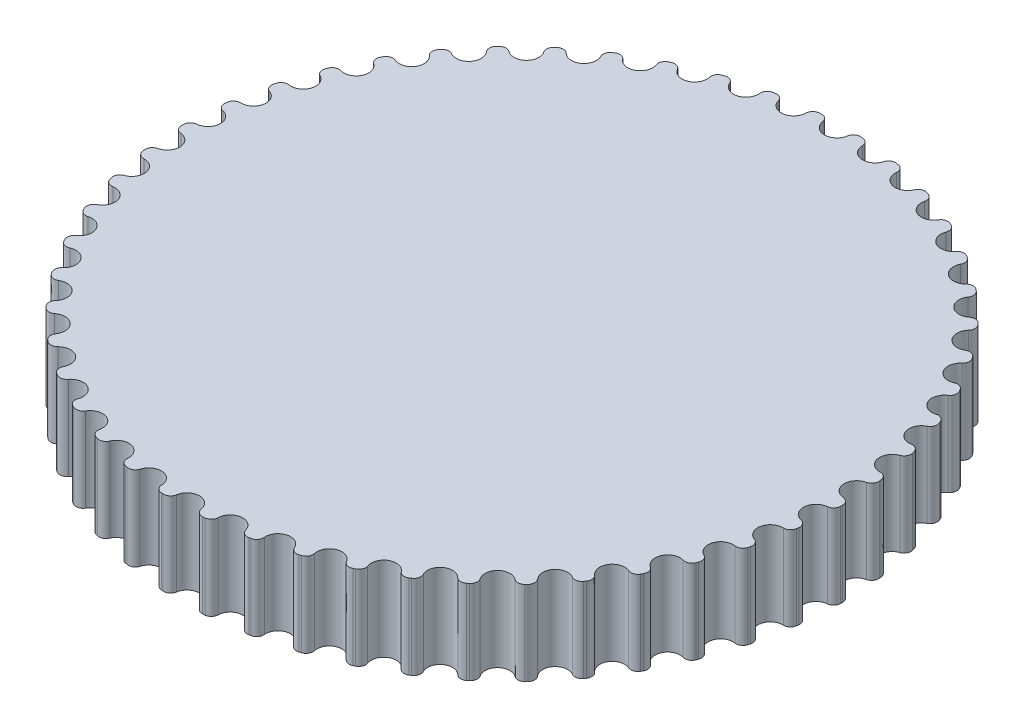
from build123d import *

# Parameters (mm, degrees)
BOSS_EXTRUDE1_DEPTH = 3
CIRPATTERN1_COUNT   = 50


with BuildPart() as part:
    # Sketch1 → Boss-Extrude1 (new, symmetric)
    with BuildSketch(Plane(origin=(0, 0, 0), x_dir=(1, 0, 0), z_dir=(0, 1, 0))):
        with BuildLine():
            ThreePointArc((0, 22.27212335), (0.579574136, 22.486702133), (0.879677905, 23.026968698))
            ThreePointArc((0.879677905, 23.026968698), (1.059762983, 23.340052161), (1.40375616, 23.450145689))
            ThreePointArc((1.40375616, 23.450145689), (1.475082636, 23.445767111), (1.546395464, 23.441171585))
            ThreePointArc((1.546395464, 23.441171585), (1.873877773, 23.2888324), (2.013303064, 22.955647048))
            ThreePointArc((2.013303064, 22.955647048), (2.24332707, 22.382027671), (2.791437238, 22.096501005))
            ThreePointArc((2.791437238, 22.096501005), (-1.398478196, -22.228174402), (0, 22.27212335))
        make_face()
    boss_extrude1 = extrude(amount=BOSS_EXTRUDE1_DEPTH, both=True)

    # CirPattern1: Boss-Extrude1 ×50 about axis
    cirpattern1_axis = Axis((0, 3.3, 0), (0, -1, 0))
    for i in range(1, CIRPATTERN1_COUNT):
        add(boss_extrude1.rotate(cirpattern1_axis, i * 360 / CIRPATTERN1_COUNT))


solid = part.part
